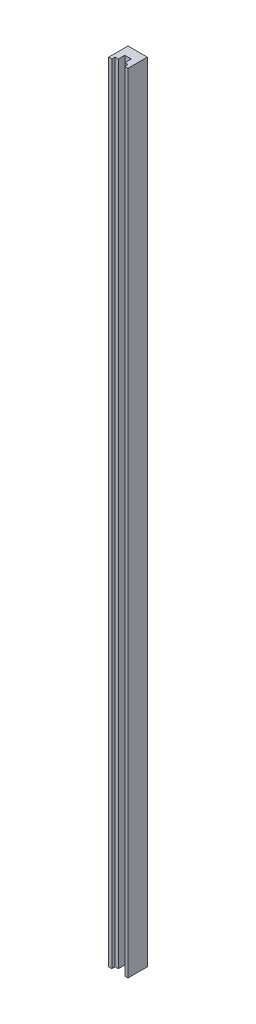
from build123d import *

# Parameters (mm, degrees)
SKETCH1_W           = 30
SKETCH1_H           = 30
BOSS_EXTRUDE1_DEPTH = 1225
CUT_EXTRUDE1_REACH  = 1227.184
SKETCH2_W           = 20
SKETCH2_H           = 5
CUT_EXTRUDE2_REACH  = 1227.184
SKETCH3_W           = 10
SKETCH3_H           = 10
SKETCH6_R           = 4
CUT_EXTRUDE3_DEPTH  = 3


with BuildPart() as part:
    # Sketch1 → Boss-Extrude1 (new body)
    with BuildSketch(Plane(origin=(0, 0, 0), x_dir=(1, 0, 0), z_dir=(0, 1, 0))):
        Rectangle(SKETCH1_W, SKETCH1_H)
    extrude(amount=BOSS_EXTRUDE1_DEPTH)

    # Sketch2 → Cut-Extrude1 (cut, up to next)
    with BuildSketch(Plane(origin=(0, 1225, 0), x_dir=(1, 0, 0), z_dir=(0, 1, 0)), mode=Mode.PRIVATE) as cut_extrude1_sk1:
        with Locations((0, -12.5)):
            Rectangle(SKETCH2_W, SKETCH2_H)
    cut_extrude1_tool1 = extrude(cut_extrude1_sk1.sketch, amount=-CUT_EXTRUDE1_REACH, mode=Mode.PRIVATE) & part.part
    add(cut_extrude1_tool1.solids().sort_by_distance((0, 1225, 12.5))[0], mode=Mode.SUBTRACT)

    # Sketch3 → Cut-Extrude2 (cut, up to next)
    with BuildSketch(Plane(origin=(0, 1225, 0), x_dir=(1, 0, 0), z_dir=(0, 1, 0)), mode=Mode.PRIVATE) as cut_extrude2_sk1:
        with Locations((0, -5)):
            Rectangle(SKETCH3_W, SKETCH3_H)
    cut_extrude2_tool1 = extrude(cut_extrude2_sk1.sketch, amount=-CUT_EXTRUDE2_REACH, mode=Mode.PRIVATE) & part.part
    add(cut_extrude2_tool1.solids().sort_by_distance((0, 1225, 5))[0], mode=Mode.SUBTRACT)

    # Sketch6 → Cut-Extrude3 (cut)
    with BuildSketch(Plane(origin=(0, 0, -15), x_dir=(-1, 0, 0), z_dir=(0, 0, -1))):
        with Locations((0, 1200)):
            Circle(SKETCH6_R)
        with Locations((0, 1000)):
            Circle(SKETCH6_R)
        with Locations((0, 800)):
            Circle(SKETCH6_R)
        with Locations((0, 700)):
            Circle(SKETCH6_R)
        with Locations((0, 650)):
            Circle(SKETCH6_R)
        with Locations((0, 600)):
            Circle(SKETCH6_R)
        with Locations((0, 550)):
            Circle(SKETCH6_R)
        with Locations((0, 500)):
            Circle(SKETCH6_R)
        with Locations((0, 450)):
            Circle(SKETCH6_R)
        with Locations((0, 400)):
            Circle(SKETCH6_R)
        with Locations((0, 350)):
            Circle(SKETCH6_R)
        with Locations((0, 300)):
            Circle(SKETCH6_R)
        with Locations((0, 250)):
            Circle(SKETCH6_R)
        with Locations((0, 200)):
            Circle(SKETCH6_R)
    extrude(amount=-CUT_EXTRUDE3_DEPTH, mode=Mode.SUBTRACT)


solid = part.part
